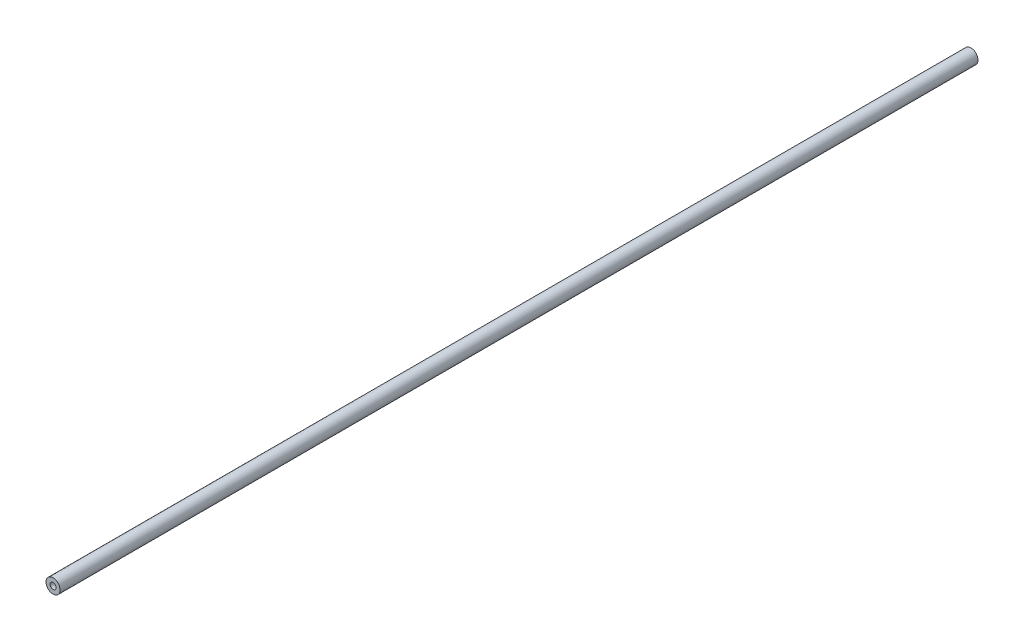
from build123d import *

# Parameters (mm, degrees)
SKETCH1_R                            = 4.7625
BOSS_EXTRUDE1_DEPTH                  = 309.31104
F_10_32_TAPPED_HOLE1_D               = 4.0386
F_10_32_TAPPED_HOLE1_DEPTH           = 12.02944
F_10_32_TAPPED_HOLE1_TIP             = 1.213317848
F_10_32_TAPPED_HOLE1_ON_FACE_2_D     = 4.0386
F_10_32_TAPPED_HOLE1_ON_FACE_2_DEPTH = 12.02944
F_10_32_TAPPED_HOLE1_ON_FACE_2_TIP   = 1.213317848


with BuildPart() as part:
    # Sketch1 → Boss-Extrude1 (new, symmetric)
    with BuildSketch(Plane.XY):
        Circle(SKETCH1_R)
    extrude(amount=BOSS_EXTRUDE1_DEPTH, both=True)

    # #10-32 Tapped Hole1
    with Locations(Plane(origin=(0, 0, -309.31104), x_dir=(-1, 0, 0), z_dir=(0, 0, -1))):
        with Locations((0, 0)):
            Hole(F_10_32_TAPPED_HOLE1_D / 2, depth=F_10_32_TAPPED_HOLE1_DEPTH)
            with Locations((0, 0, -(F_10_32_TAPPED_HOLE1_DEPTH + F_10_32_TAPPED_HOLE1_TIP / 2))):  # 118° drill point
                Cone(0, F_10_32_TAPPED_HOLE1_D / 2, F_10_32_TAPPED_HOLE1_TIP, mode=Mode.SUBTRACT)

    # #10-32 Tapped Hole1 on face 2
    with Locations(Plane.XY.offset(309.31104)):
        with Locations((0, 0)):
            Hole(F_10_32_TAPPED_HOLE1_ON_FACE_2_D / 2, depth=F_10_32_TAPPED_HOLE1_ON_FACE_2_DEPTH)
            with Locations((0, 0, -(F_10_32_TAPPED_HOLE1_ON_FACE_2_DEPTH + F_10_32_TAPPED_HOLE1_ON_FACE_2_TIP / 2))):  # 118° drill point
                Cone(0, F_10_32_TAPPED_HOLE1_ON_FACE_2_D / 2, F_10_32_TAPPED_HOLE1_ON_FACE_2_TIP, mode=Mode.SUBTRACT)


solid = part.part
